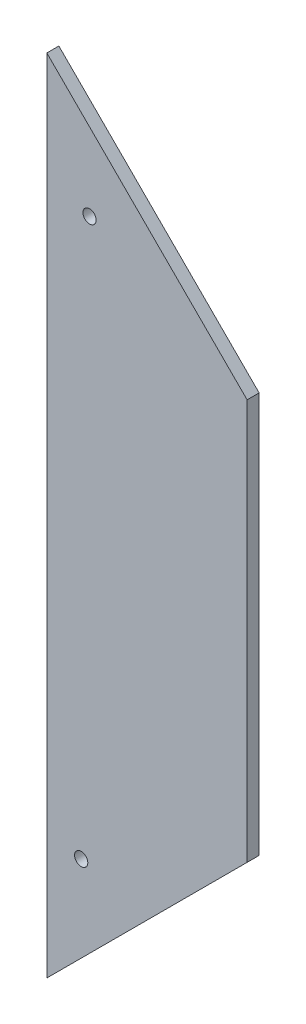
from build123d import *

# Parameters (mm, degrees)
EXTRUDE_1_DEPTH     = 3
SKETCH_5_R          = 1.65
CUT_EXTRUDE_1_DEPTH = 8


with BuildPart() as part:
    # Эскиз1 → Бобышка-Вытянуть1 (new body)
    with BuildSketch(Plane.XY):
        Polygon((0, 0), (0, 200), (50, 150), (50, 50), align=None)
    extrude(amount=EXTRUDE_1_DEPTH)

    # Эскиз5 → Вырез-Вытянуть1 (cut)
    with BuildSketch(Plane(origin=(-305.961161651, -184.204468703, -1.5), x_dir=(-0.9998892265297747, 0.01488404077153568, 0), z_dir=(0, 0, -1))):
        with Locations((-311.309295343, 358.877763083)):
            Circle(SKETCH_5_R)
        with Locations((-311.309295343, 218.877763083)):
            Circle(SKETCH_5_R)
    extrude(amount=-CUT_EXTRUDE_1_DEPTH, mode=Mode.SUBTRACT)


solid = part.part
